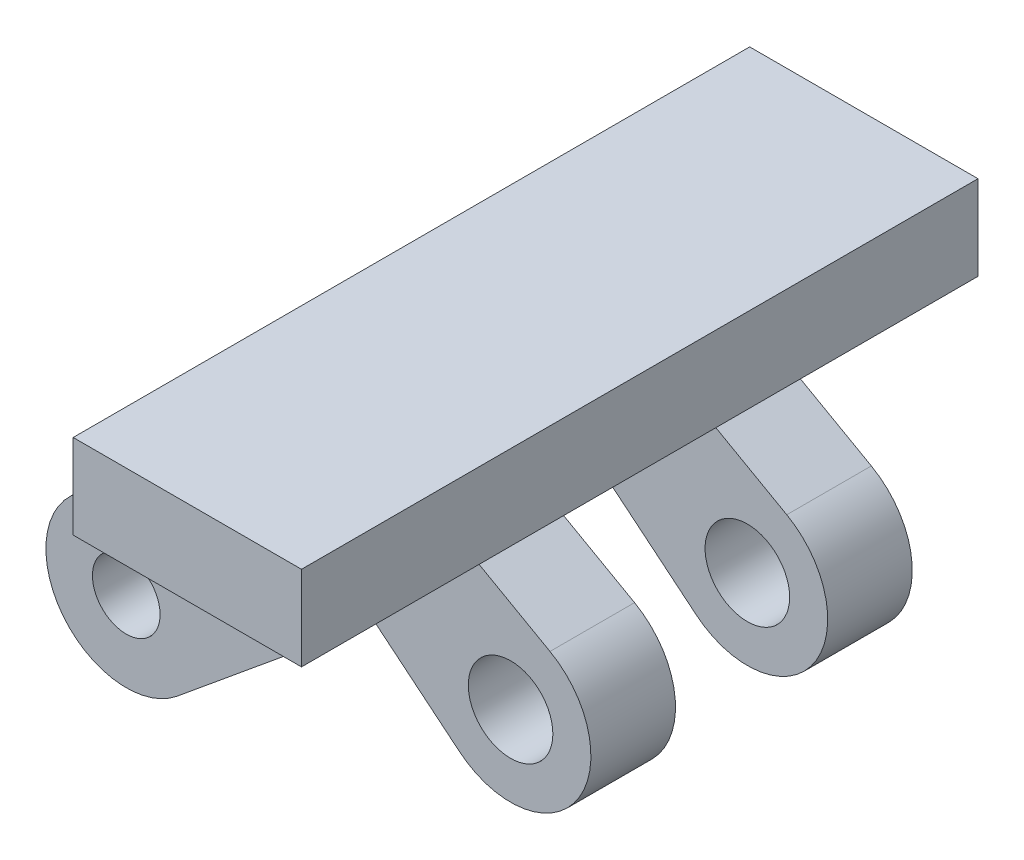
from build123d import *

# Parameters (mm, degrees)
EXTRUDE_1_DEPTH      = 8
EXTRUDE_1_DEPTH_BACK = 8
SKETCH_1_W           = 5.4
SKETCH_1_H           = 2
SKETCH_3_R           = 0.8
EXTRUDE_2_DEPTH      = 2
SKETCH_5_R           = 1
EXTRUDE_3_DEPTH      = 2


with BuildPart() as part:
    # 草图1 → 凸台-拉伸1 (new, two sides: drawn at the far end of the back side and taken through both)
    with BuildSketch(Plane.XY.offset(-EXTRUDE_1_DEPTH_BACK)):
        with Locations((2.7, -1)):
            Rectangle(SKETCH_1_W, SKETCH_1_H)
    extrude(amount=EXTRUDE_1_DEPTH + EXTRUDE_1_DEPTH_BACK)

    # 草图3 → 凸台-拉伸2 (add)
    with BuildSketch(Plane.XY.offset(6)):
        with BuildLine():
            Line((5.4, -2), (0, -2))
            Line((0, -2), (-1.677229227, -2.944418933))
            ThreePointArc((-1.677229227, -2.944418933), (-2.312144702, -5.674270675), (0.462980792, -6.066554604))
            Line((0.462980792, -6.066554604), (5.4, -2))
        make_face()
        with Locations((-0.745, -4.6)):
            Circle(SKETCH_3_R, mode=Mode.SUBTRACT)
    extrude_2 = extrude(amount=-EXTRUDE_2_DEPTH)

    # 草图5 → 凸台-拉伸3 (add)
    with BuildSketch(Plane.XY.offset(3.8)):
        with BuildLine():
            Line((7.077229227, -2.944418933), (5.4, -2))
            Line((5.4, -2), (0, -2))
            Line((0, -2), (4.937019208, -6.066554604))
            ThreePointArc((4.937019208, -6.066554604), (7.712144702, -5.674270675), (7.077229227, -2.944418933))
        make_face()
        with Locations((6.145, -4.6)):
            Circle(SKETCH_5_R, mode=Mode.SUBTRACT)
    extrude_3 = extrude(amount=-EXTRUDE_3_DEPTH)

    # 镜向1: 凸台-拉伸2, 凸台-拉伸3 across plane
    add(extrude_2.mirror(Plane.XY))
    add(extrude_3.mirror(Plane.XY))


solid = part.part
